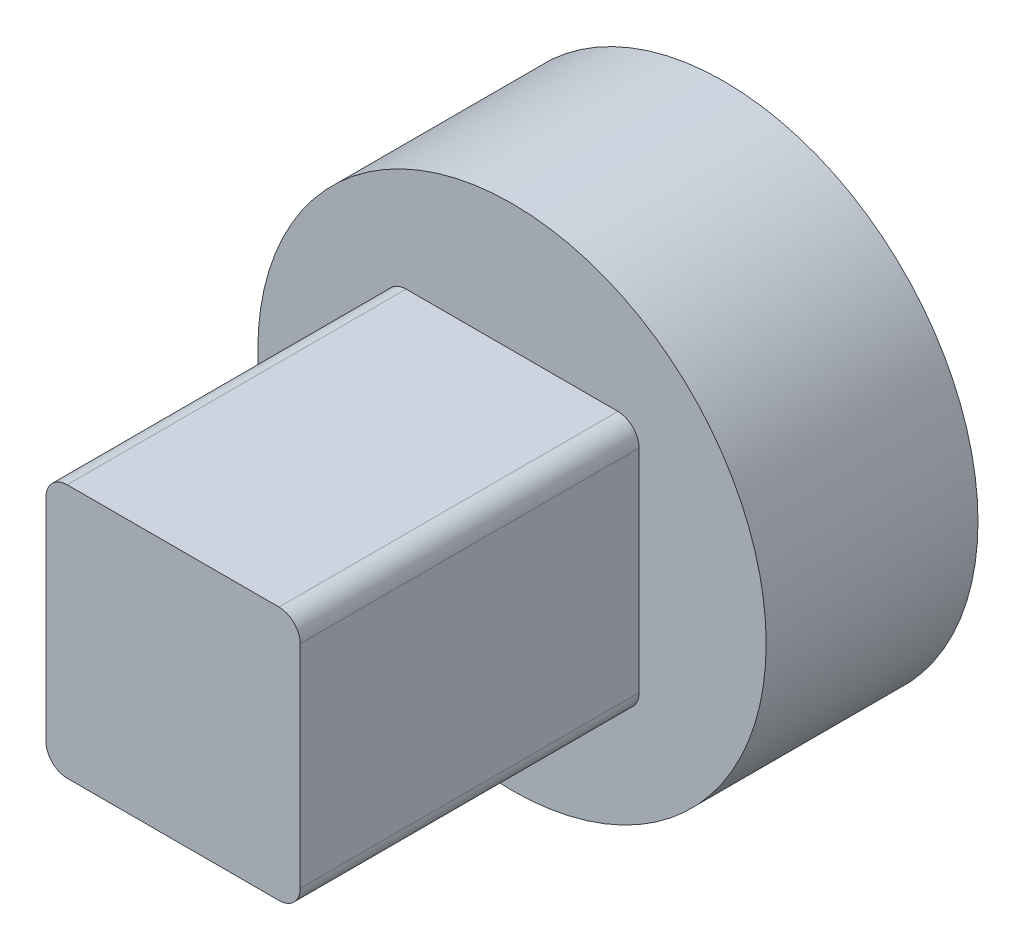
from build123d import *

# Parameters (mm, degrees)
SKETCH1_R           = 6
SKETCH1_R_2         = 2.5
BOSS_EXTRUDE1_DEPTH = 5
BOSS_EXTRUDE2_DEPTH = 8


with BuildPart() as part:
    # Sketch1 → Boss-Extrude1 (new body)
    with BuildSketch(Plane.XY.offset(-23.465471353)):
        with Locations((3.740457308, -31.828386779)):
            Circle(SKETCH1_R)
        with Locations((3.740457308, -31.828386779)):
            Circle(SKETCH1_R_2, mode=Mode.SUBTRACT)
    extrude(amount=BOSS_EXTRUDE1_DEPTH)

    # Sketch2 → Boss-Extrude2 (add)
    with BuildSketch(Plane.XY.offset(-18.465471353)):
        with BuildLine():
            Line((6.240457308, -28.828386779), (1.240457308, -28.828386779))
            ThreePointArc((1.240457308, -28.828386779), (0.886903918, -28.974833388), (0.740457308, -29.328386779))
            Line((0.740457308, -29.328386779), (0.740457308, -34.328386779))
            ThreePointArc((0.740457308, -34.328386779), (0.886903918, -34.681940169), (1.240457308, -34.828386779))
            Line((1.240457308, -34.828386779), (6.240457308, -34.828386779))
            ThreePointArc((6.240457308, -34.828386779), (6.594010699, -34.681940169), (6.740457308, -34.328386779))
            Line((6.740457308, -34.328386779), (6.740457308, -29.328386779))
            ThreePointArc((6.740457308, -29.328386779), (6.594010699, -28.974833388), (6.240457308, -28.828386779))
        make_face()
    extrude(amount=BOSS_EXTRUDE2_DEPTH)


solid = part.part
